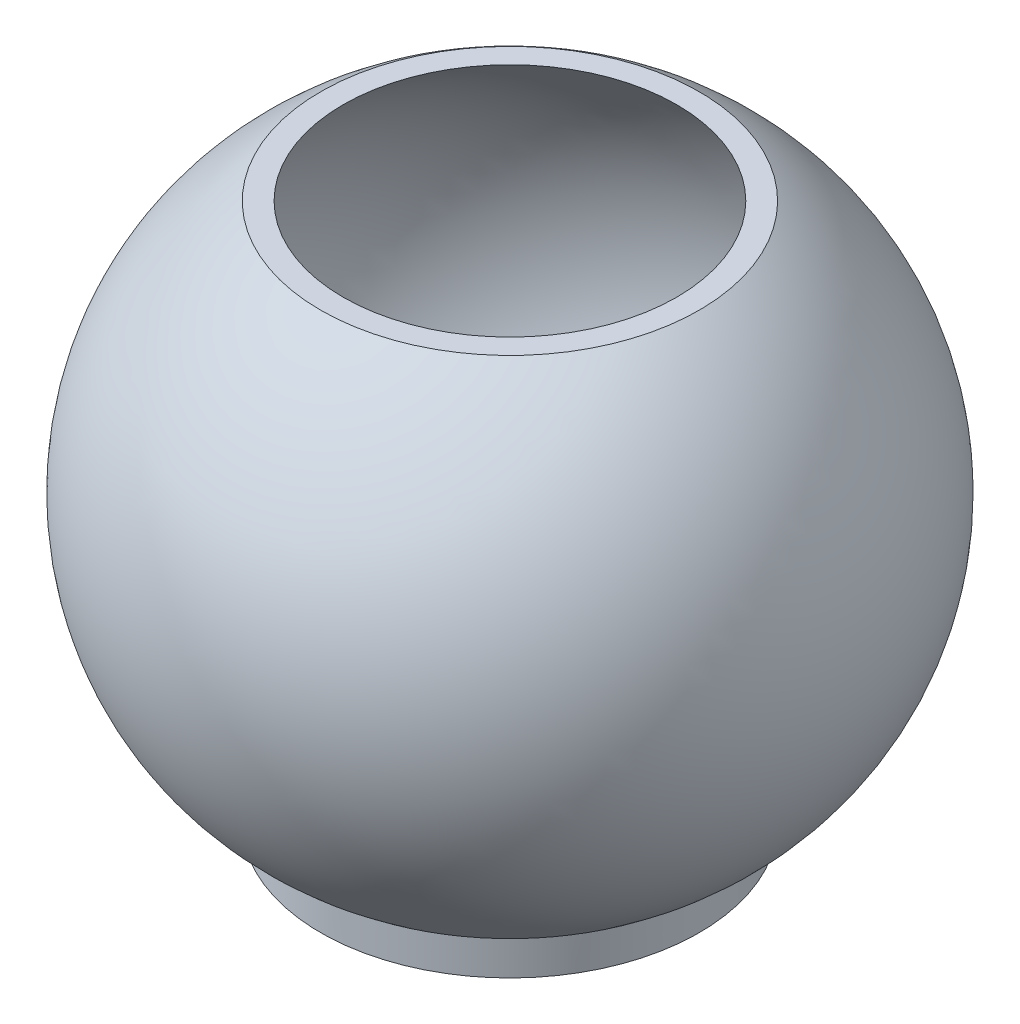
from build123d import *

# Parameters (mm, degrees)
SKETCH2_8_W        = 209.55
SKETCH2_8_H        = 38.1
SKETCH3_R          = 196.85
CUT_EXTRUDE1_DEPTH = 340.106


# Read off the part's stored shape, not the designer's step: Shell6
with BuildPart() as part:
    # Sketch2 → Revolve5 (revolve)
    with BuildSketch(Plane.XY, mode=Mode.PRIVATE) as revolve5_sk:
        with BuildLine():
            Line((209.55, 38.1), (0, 38.1))
            Line((0, 38.1), (0, 596.9))
            Line((0, 596.9), (209.55, 596.9))
            ThreePointArc((209.55, 596.9), (362.672023, 317.5), (209.55, 38.1))
        make_face()
    revolve(revolve5_sk.sketch.rotate(Axis((0, 0, 0), (0, -1, 0)), 90), axis=Axis((0, 0, 0), (0, -1, 0)))

    # Sketch2<8> → Revolve6 (revolve)
    with BuildSketch(Plane.XY, mode=Mode.PRIVATE) as revolve6_sk:
        with Locations((104.775, 19.05)):
            Rectangle(SKETCH2_8_W, SKETCH2_8_H)
    revolve(revolve6_sk.sketch.rotate(Axis((0, 0, 0), (0, -1, 0)), 90), axis=Axis((0, 0, 0), (0, -1, 0)))

    # Shell6 outline → Shell6 (revolve, cut)
    with BuildSketch(Plane.XY):
        with BuildLine():
            Line((184.661962072, 596.9), (0, 596.9))
            Line((0, 596.9), (0, 12.7))
            Line((0, 12.7), (196.85, 12.7))
            Line((196.85, 12.7), (196.85, 45.14901209))
            ThreePointArc((196.85, 45.14901209), (349.89427846, 324.539830253), (184.661962072, 596.9))
        make_face()
    revolve(axis=Axis((0, 0, 0), (0, 1, 0)), mode=Mode.SUBTRACT)

    # Sketch3 → Cut-Extrude1 (cut)
    with BuildSketch(Plane(origin=(0, 12.7, 0), x_dir=(1, 0, 0), z_dir=(0, 1, 0))):
        with Locations(Location((0, 0, 0), (0, 0, 90))):
            Circle(SKETCH3_R)
    extrude(amount=-CUT_EXTRUDE1_DEPTH, mode=Mode.SUBTRACT)


solid = part.part
